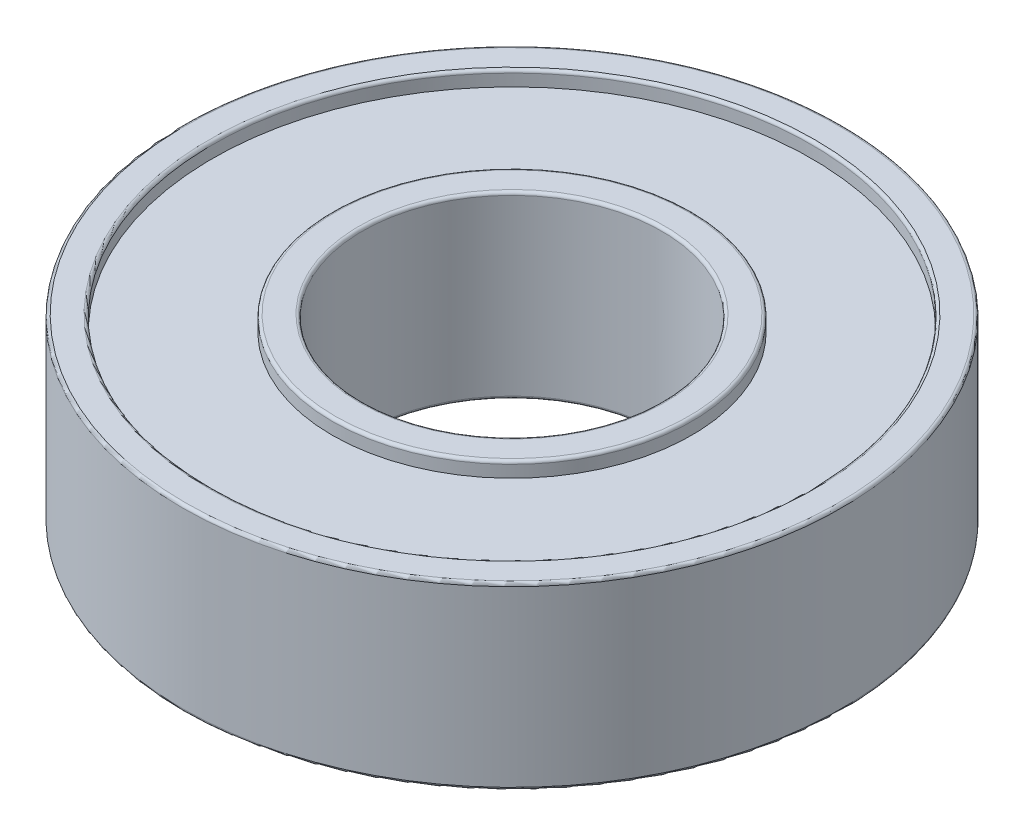
from build123d import *


with BuildPart() as part:
    # 草图1 → 旋转1 (revolve)
    with BuildSketch(Plane(origin=(0, 0, 0), x_dir=(-1, 0, 0), z_dir=(0, 0, -1))):
        with BuildLine():
            Line((-5.1, 3), (-5.9, 3))
            ThreePointArc((-5.9, 3), (-5.970710678, 2.970710678), (-6, 2.9))
            Line((-6, 2.9), (-6, 2.5))
            Line((-6, 2.5), (-10, 2.5))
            Line((-10, 2.5), (-10, 2.9))
            ThreePointArc((-10, 2.9), (-10.029289322, 2.970710678), (-10.1, 3))
            Line((-10.1, 3), (-10.9, 3))
            ThreePointArc((-10.9, 3), (-10.970710678, 2.970710678), (-11, 2.9))
            Line((-11, 2.9), (-11, -2.9))
            ThreePointArc((-11, -2.9), (-10.970710678, -2.970710678), (-10.9, -3))
            Line((-10.9, -3), (-10.1, -3))
            ThreePointArc((-10.1, -3), (-10.029289322, -2.970710678), (-10, -2.9))
            Line((-10, -2.9), (-10, -2.5))
            Line((-10, -2.5), (-6, -2.5))
            Line((-6, -2.5), (-6, -2.9))
            ThreePointArc((-6, -2.9), (-5.970710678, -2.970710678), (-5.9, -3))
            Line((-5.9, -3), (-5.1, -3))
            ThreePointArc((-5.1, -3), (-5.029289322, -2.970710678), (-5, -2.9))
            Line((-5, -2.9), (-5, 2.9))
            ThreePointArc((-5, 2.9), (-5.029289322, 2.970710678), (-5.1, 3))
        make_face()
    revolve(axis=Axis((0, -3, 0), (0, 1, 0)))


solid = part.part
